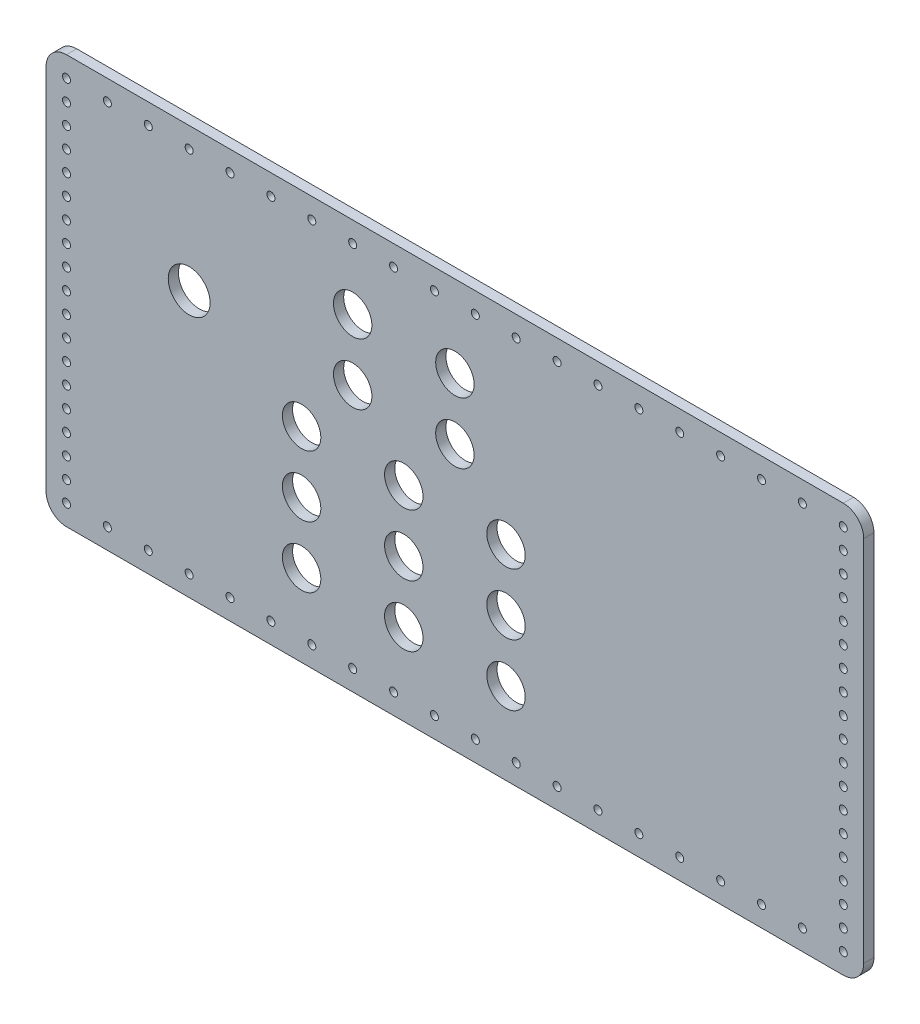
from build123d import *

# Parameters (mm, degrees)
SKETCH1_W           = 508
SKETCH1_H           = 254
BOSS_EXTRUDE1_DEPTH = 6.35
SKETCH3_R           = 11.938
SKETCH3_R_2         = 13
CUT_EXTRUDE2_DEPTH  = 568.996762755
SKETCH4_R           = 2.4892
CUT_EXTRUDE3_DEPTH  = 568.996762755
FILLET1_R           = 12.7


with BuildPart() as part:
    # Sketch1 → Boss-Extrude1 (new body)
    with BuildSketch(Plane.XY):
        with Locations((254, 127)):
            Rectangle(SKETCH1_W, SKETCH1_H)
    extrude(amount=BOSS_EXTRUDE1_DEPTH)

    # Sketch3 → Cut-Extrude2 (cut, through all)
    with BuildSketch(Plane(origin=(0, 0, 0), x_dir=(-1, 0, 0), z_dir=(0, 0, -1))):
        with Locations((-158.75, 88.9)):
            Circle(SKETCH3_R)
        with Locations((-222.25, 88.9)):
            Circle(SKETCH3_R)
        with Locations((-158.75, 50.8)):
            Circle(SKETCH3_R)
        with Locations((-222.25, 50.8)):
            Circle(SKETCH3_R)
        with Locations((-222.25, 127)):
            Circle(SKETCH3_R)
        with Locations((-285.75, 127)):
            Circle(SKETCH3_R)
        with Locations((-285.75, 88.9)):
            Circle(SKETCH3_R)
        with Locations((-285.75, 50.8)):
            Circle(SKETCH3_R)
        with Locations((-254, 203.2)):
            Circle(SKETCH3_R)
        with Locations((-190.5, 203.2)):
            Circle(SKETCH3_R)
        with Locations((-158.75, 127)):
            Circle(SKETCH3_R)
        with Locations((-190.5, 165.1)):
            Circle(SKETCH3_R)
        with Locations((-254, 165.1)):
            Circle(SKETCH3_R)
        with Locations((-88.9, 165.1)):
            Circle(SKETCH3_R_2)
    extrude(amount=-CUT_EXTRUDE2_DEPTH, mode=Mode.SUBTRACT)

    # Sketch4 → Cut-Extrude3 (cut, through all)
    with BuildSketch(Plane(origin=(0, 0, 0), x_dir=(-1, 0, 0), z_dir=(0, 0, -1))):
        with Locations((-12.7, 241.3)):
            Circle(SKETCH4_R)
        with Locations((-38.1, 241.3)):
            Circle(SKETCH4_R)
        with Locations((-63.5, 241.3)):
            Circle(SKETCH4_R)
        with Locations((-88.9, 241.3)):
            Circle(SKETCH4_R)
        with Locations((-114.3, 241.3)):
            Circle(SKETCH4_R)
        with Locations((-139.7, 241.3)):
            Circle(SKETCH4_R)
        with Locations((-165.1, 241.3)):
            Circle(SKETCH4_R)
        with Locations((-190.5, 241.3)):
            Circle(SKETCH4_R)
        with Locations((-215.9, 241.3)):
            Circle(SKETCH4_R)
        with Locations((-241.3, 241.3)):
            Circle(SKETCH4_R)
        with Locations((-266.7, 241.3)):
            Circle(SKETCH4_R)
        with Locations((-292.1, 241.3)):
            Circle(SKETCH4_R)
        with Locations((-317.5, 241.3)):
            Circle(SKETCH4_R)
        with Locations((-342.9, 241.3)):
            Circle(SKETCH4_R)
        with Locations((-368.3, 241.3)):
            Circle(SKETCH4_R)
        with Locations((-393.7, 241.3)):
            Circle(SKETCH4_R)
        with Locations((-419.1, 241.3)):
            Circle(SKETCH4_R)
        with Locations((-444.5, 241.3)):
            Circle(SKETCH4_R)
        with Locations((-469.9, 241.3)):
            Circle(SKETCH4_R)
        with Locations((-495.3, 241.3)):
            Circle(SKETCH4_R)
        with Locations((-495.3, 228.6)):
            Circle(SKETCH4_R)
        with Locations((-12.7, 228.6)):
            Circle(SKETCH4_R)
        with Locations((-495.3, 215.9)):
            Circle(SKETCH4_R)
        with Locations((-12.7, 215.9)):
            Circle(SKETCH4_R)
        with Locations((-495.3, 203.2)):
            Circle(SKETCH4_R)
        with Locations((-12.7, 203.2)):
            Circle(SKETCH4_R)
        with Locations((-495.3, 190.5)):
            Circle(SKETCH4_R)
        with Locations((-12.7, 190.5)):
            Circle(SKETCH4_R)
        with Locations((-495.3, 177.8)):
            Circle(SKETCH4_R)
        with Locations((-12.7, 177.8)):
            Circle(SKETCH4_R)
        with Locations((-495.3, 165.1)):
            Circle(SKETCH4_R)
        with Locations((-12.7, 165.1)):
            Circle(SKETCH4_R)
        with Locations((-495.3, 152.4)):
            Circle(SKETCH4_R)
        with Locations((-12.7, 152.4)):
            Circle(SKETCH4_R)
        with Locations((-495.3, 139.7)):
            Circle(SKETCH4_R)
        with Locations((-12.7, 139.7)):
            Circle(SKETCH4_R)
        with Locations((-495.3, 127)):
            Circle(SKETCH4_R)
        with Locations((-12.7, 127)):
            Circle(SKETCH4_R)
        with Locations((-495.3, 114.3)):
            Circle(SKETCH4_R)
        with Locations((-12.7, 114.3)):
            Circle(SKETCH4_R)
        with Locations((-495.3, 101.6)):
            Circle(SKETCH4_R)
        with Locations((-12.7, 101.6)):
            Circle(SKETCH4_R)
        with Locations((-495.3, 88.9)):
            Circle(SKETCH4_R)
        with Locations((-12.7, 88.9)):
            Circle(SKETCH4_R)
        with Locations((-495.3, 76.2)):
            Circle(SKETCH4_R)
        with Locations((-12.7, 76.2)):
            Circle(SKETCH4_R)
        with Locations((-495.3, 63.5)):
            Circle(SKETCH4_R)
        with Locations((-12.7, 63.5)):
            Circle(SKETCH4_R)
        with Locations((-495.3, 50.8)):
            Circle(SKETCH4_R)
        with Locations((-12.7, 50.8)):
            Circle(SKETCH4_R)
        with Locations((-495.3, 38.1)):
            Circle(SKETCH4_R)
        with Locations((-12.7, 38.1)):
            Circle(SKETCH4_R)
        with Locations((-495.3, 25.4)):
            Circle(SKETCH4_R)
        with Locations((-12.7, 25.4)):
            Circle(SKETCH4_R)
        with Locations((-495.3, 12.7)):
            Circle(SKETCH4_R)
        with Locations((-12.7, 12.7)):
            Circle(SKETCH4_R)
        with Locations((-469.9, 12.7)):
            Circle(SKETCH4_R)
        with Locations((-444.5, 12.7)):
            Circle(SKETCH4_R)
        with Locations((-419.1, 12.7)):
            Circle(SKETCH4_R)
        with Locations((-393.7, 12.7)):
            Circle(SKETCH4_R)
        with Locations((-368.3, 12.7)):
            Circle(SKETCH4_R)
        with Locations((-342.9, 12.7)):
            Circle(SKETCH4_R)
        with Locations((-317.5, 12.7)):
            Circle(SKETCH4_R)
        with Locations((-292.1, 12.7)):
            Circle(SKETCH4_R)
        with Locations((-266.7, 12.7)):
            Circle(SKETCH4_R)
        with Locations((-241.3, 12.7)):
            Circle(SKETCH4_R)
        with Locations((-215.9, 12.7)):
            Circle(SKETCH4_R)
        with Locations((-190.5, 12.7)):
            Circle(SKETCH4_R)
        with Locations((-165.1, 12.7)):
            Circle(SKETCH4_R)
        with Locations((-139.7, 12.7)):
            Circle(SKETCH4_R)
        with Locations((-114.3, 12.7)):
            Circle(SKETCH4_R)
        with Locations((-88.9, 12.7)):
            Circle(SKETCH4_R)
        with Locations((-63.5, 12.7)):
            Circle(SKETCH4_R)
        with Locations((-38.1, 12.7)):
            Circle(SKETCH4_R)
    extrude(amount=-CUT_EXTRUDE3_DEPTH, mode=Mode.SUBTRACT)

    # Fillet1
    fillet1_edges = [part.edges().sort_by_distance(p)[0] for p in [
        (508, 0, 3.175),
        (0, 0, 3.175),
        (0, 254, 3.175),
        (508, 254, 3.175),
    ]]
    fillet(fillet1_edges, radius=FILLET1_R)


solid = part.part
